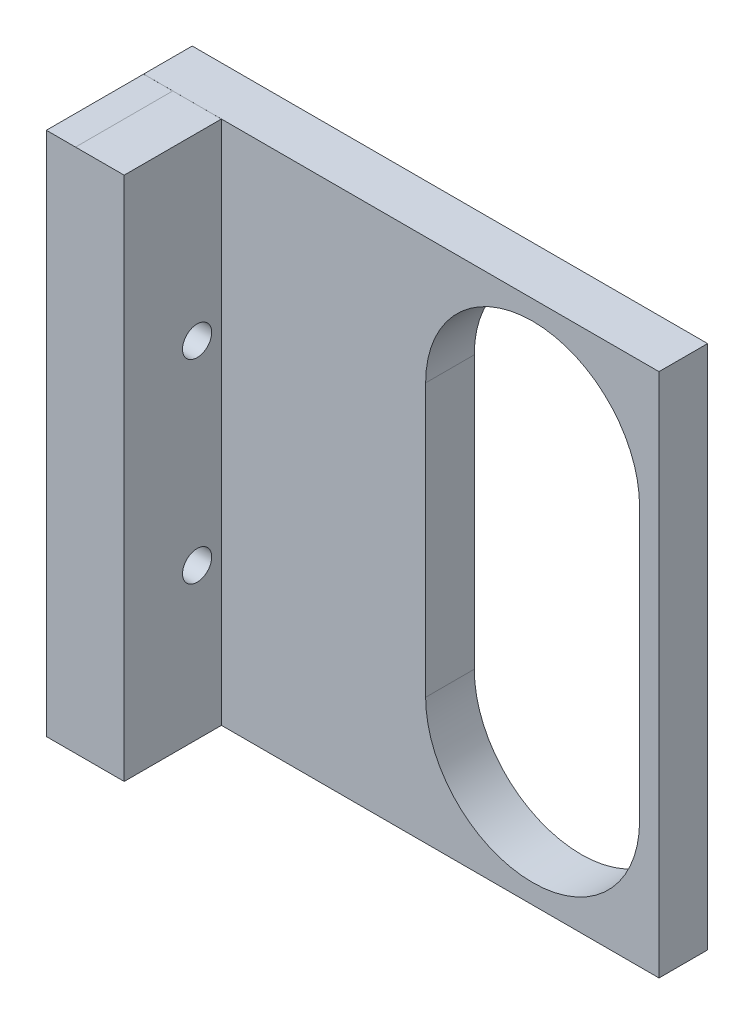
from build123d import *
from OCP.BRepAlgoAPI import BRepAlgoAPI_Cut
from OCP.TopTools import TopTools_ListOfShape

# Parameters (mm, degrees)
EXTRUDE_1_DEPTH           = 5
CUT_EXTRUDE_11_DEPTH      = 5
EXTRUDE_2_DEPTH           = 10
CUT_EXTRUDE_12_DEPTH      = 81.17087367981851
CUT_EXTRUDE_12_DEPTH_BACK = 10
SKETCH_5_R                = 1.5000000000000018
SKETCH_5_R_2              = 1.5000000000000009
EXTRUDE_3_DEPTH           = 5
SKETCH_7_R                = 1.5
SKETCH_7_R_2              = 1.5000000000000009
CUT_EXTRUDE_13_DEPTH      = 5


with BuildPart() as part:
    # 草图2 → 凸台-拉伸1 (new body)
    with BuildSketch(Plane.XY):
        Polygon((12.999999835407609, 4.25), (-40.000000164592386, 4.25), (-40.003932239355336, 58.24999985684064), (12.996067760644666, 58.24999985684064), align=None)
    extrude(amount=EXTRUDE_1_DEPTH)

    # 草图3 → 切除-拉伸11 (cut)
    with BuildSketch(Plane.XY):
        with BuildLine():
            Line((-11, 17.25), (-11.000000000000094, 45.25))
            ThreePointArc((-11.000000000000094, 45.25), (6.7e-16, 56.25000000000009), (10.999999999999904, 45.25))
            Line((10.999999999999904, 45.25), (11, 17.25))
            ThreePointArc((11, 17.25), (-2.02e-15, 6.25), (-11, 17.25))
        make_face()
    extrude(amount=CUT_EXTRUDE_11_DEPTH, mode=Mode.SUBTRACT)

    # 草图4 → 凸台-拉伸2 (add)
    with BuildSketch(Plane.XY.offset(5.000000000000191)):
        Polygon((-40.000000164592386, 4.249999999999965), (-37.000000164592386, 4.249999999999965), (-37.00393205237581, 58.2474320282368), (-40.00393205237581, 58.2474320282368), align=None)
    extrude(amount=EXTRUDE_2_DEPTH)

    # 草图5 → 切除-拉伸12 (cut, two sides: drawn at the far end of the back side and taken through both)
    with BuildSketch(Plane(origin=(-39.99969048365817, -0.00291262544246913, 0), x_dir=(0, 0, 1), z_dir=(-0.9999999973489007, -7.281619931377766e-05, 0)).offset(-CUT_EXTRUDE_12_DEPTH_BACK)):
        with Locations((7.500000000000138, 19.752912636717365)):
            Circle(SKETCH_5_R)
        with Locations((7.500000000000069, 39.75291263671736)):
            Circle(SKETCH_5_R_2)
    extrude(amount=CUT_EXTRUDE_12_DEPTH + CUT_EXTRUDE_12_DEPTH_BACK, mode=Mode.SUBTRACT)

    # 草图6 → 凸台-拉伸3 (add)
    with BuildSketch(Plane(origin=(-36.999690499564764, -0.0026941768451054, 0), x_dir=(0, 0, -1), z_dir=(0.9999999973489007, 7.281619931373636e-05, 0))):
        Polygon((-15.00000000000019, 58.25012635950883), (-5.000000000000191, 58.25012635950883), (-5, 4.249053378153735), (-15.00000000000019, 4.252694188119421), align=None)
    extrude(amount=EXTRUDE_3_DEPTH)


with BuildPart() as cut_extrude_13_tool:
    # 草图7 → 切除-拉伸13 (new body)
    with BuildSketch(Plane(origin=(-31.99969051282027, -0.00233009584853671, 0), x_dir=(0, 0, -1), z_dir=(0.9999999973489007, 7.281619931373636e-05, 0))):
        with Locations((-7.500000000000126, 39.75012635950883)):
            Circle(SKETCH_7_R)
        with Locations((-7.500000000000058, 19.750126359508837)):
            Circle(SKETCH_7_R_2)
    extrude(amount=-CUT_EXTRUDE_13_DEPTH)


with BuildPart() as part_1:
    add(part.part)

    # 切除-拉伸13: cut by cut_extrude_13_tool, with a tolerance
    cut_extrude_13_stock = TopTools_ListOfShape()
    cut_extrude_13_stock.Append(part_1.part.wrapped)
    cut_extrude_13_tools = TopTools_ListOfShape()
    cut_extrude_13_tools.Append(cut_extrude_13_tool.part.wrapped)
    cut_extrude_13_cut = BRepAlgoAPI_Cut()
    cut_extrude_13_cut.SetArguments(cut_extrude_13_stock)
    cut_extrude_13_cut.SetTools(cut_extrude_13_tools)
    cut_extrude_13_cut.SetFuzzyValue(0.00001)
    cut_extrude_13_cut.Build()
    add(Compound.cast(cut_extrude_13_cut.Shape()).solids(), mode=Mode.REPLACE)


solid = part_1.part
